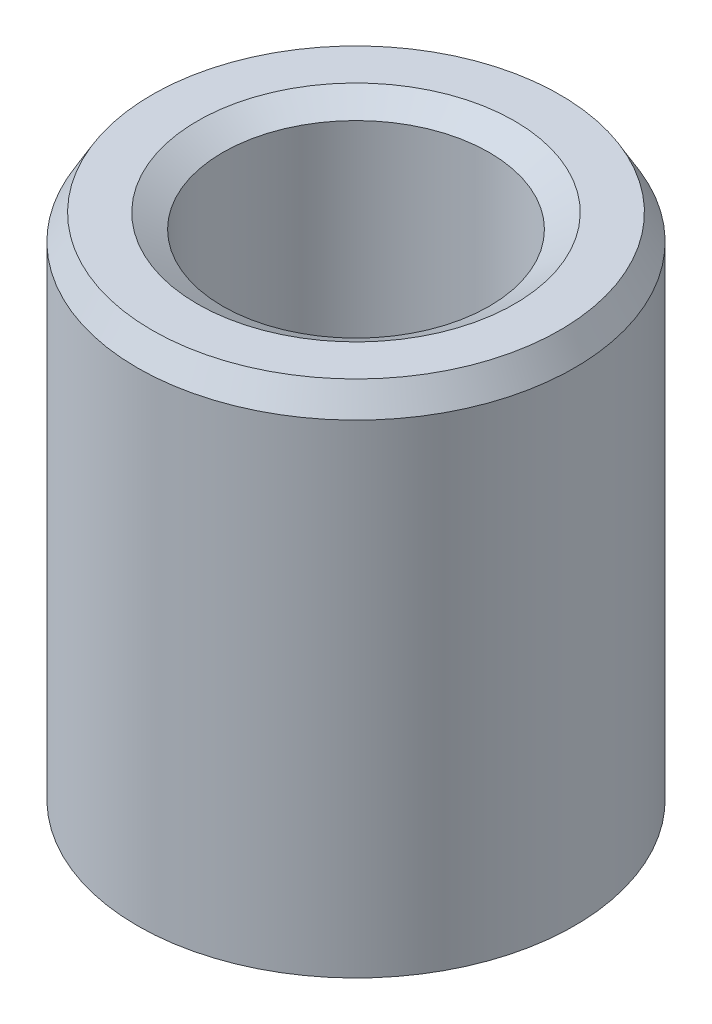
from build123d import *
from OCP.BRepFilletAPI import BRepFilletAPI_MakeChamfer

# Parameters (mm, degrees)
SKETCH1_R           = 15
BOSS_EXTRUDE1_DEPTH = 35.89326035
SKETCH2_R           = 9.144372349
CUT_EXTRUDE1_DEPTH  = 42.693238523
CHAMFER1_SIZE       = 1.737065744
CHAMFER1_SIZE2      = 1.002895375


with BuildPart() as part:
    # Sketch1 → Boss-Extrude1 (new body)
    with BuildSketch(Plane(origin=(0, 0, 0), x_dir=(1, 0, 0), z_dir=(0, 1, 0))):
        Circle(SKETCH1_R)
    extrude(amount=BOSS_EXTRUDE1_DEPTH)

    # Sketch2 → Cut-Extrude1 (cut, through all)
    with BuildSketch(Plane(origin=(0, 0, 0), x_dir=(1, 0, 0), z_dir=(0, 1, 0))):
        Circle(SKETCH2_R)
    extrude(amount=CUT_EXTRUDE1_DEPTH, mode=Mode.SUBTRACT)

    # Chamfer1: one chamfer whose edges measure the first distance from different faces: ONE call of the kernel's chamfer builder (chamfer() names one face for all edges)
    chamfer1_edges_1 = [part.edges().sort_by_distance(p)[0] for p in [
        (-9.144372349, 35.89326035, 0),
    ]]
    chamfer1_side_1 = [part.faces().sort_by_distance(p)[0] for p in [
        (-14.575735931, 35.89326035, 0),
    ]]
    chamfer1_edges_2 = [part.edges().sort_by_distance(p)[0] for p in [
        (-9.144372349, 0, 0),
    ]]
    chamfer1_side_2 = [part.faces().sort_by_distance(p)[0] for p in [
        (-9.144372349, 17.946630175, 0),
    ]]
    chamfer1_edges_3 = [part.edges().sort_by_distance(p)[0] for p in [
        (-15, 0, 0),
    ]]
    chamfer1_side_3 = [part.faces().sort_by_distance(p)[0] for p in [
        (-14.575735931, 0, 0),
    ]]
    chamfer1_edges_4 = [part.edges().sort_by_distance(p)[0] for p in [
        (-15, 35.89326035, 0),
    ]]
    chamfer1_side_4 = [part.faces().sort_by_distance(p)[0] for p in [
        (-15, 17.946630175, 0),
    ]]
    chamfer1 = BRepFilletAPI_MakeChamfer(part.part.solid().wrapped)
    for e in chamfer1_edges_1:
        chamfer1.Add(CHAMFER1_SIZE, CHAMFER1_SIZE2, e.wrapped, chamfer1_side_1[0].wrapped)  # the first distance lies on this face
    for e in chamfer1_edges_2:
        chamfer1.Add(CHAMFER1_SIZE, CHAMFER1_SIZE2, e.wrapped, chamfer1_side_2[0].wrapped)  # the first distance lies on this face
    for e in chamfer1_edges_3:
        chamfer1.Add(CHAMFER1_SIZE, CHAMFER1_SIZE2, e.wrapped, chamfer1_side_3[0].wrapped)  # the first distance lies on this face
    for e in chamfer1_edges_4:
        chamfer1.Add(CHAMFER1_SIZE, CHAMFER1_SIZE2, e.wrapped, chamfer1_side_4[0].wrapped)  # the first distance lies on this face
    add(Compound.cast(chamfer1.Shape()), mode=Mode.REPLACE)


solid = part.part
